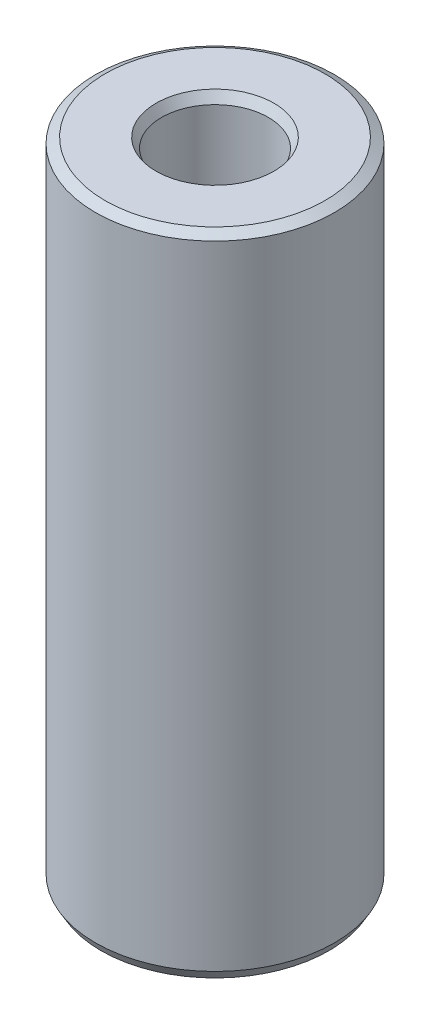
from build123d import *
from OCP.BRepFilletAPI import BRepFilletAPI_MakeChamfer

# Parameters (mm, degrees)
SKETCH1_R           = 7.5
BOSS_EXTRUDE1_DEPTH = 40.644669907
SKETCH2_R           = 3.354042675
CUT_EXTRUDE1_DEPTH  = 43.005823309
CHAMFER1_SIZE       = 0.346688844
CHAMFER1_SIZE2      = 0.600482693


with BuildPart() as part:
    # Sketch1 → Boss-Extrude1 (new body)
    with BuildSketch(Plane(origin=(0, 0, 0), x_dir=(1, 0, 0), z_dir=(0, 1, 0))):
        Circle(SKETCH1_R)
    extrude(amount=BOSS_EXTRUDE1_DEPTH)

    # Sketch2 → Cut-Extrude1 (cut, through all)
    with BuildSketch(Plane(origin=(0, 0, 0), x_dir=(1, 0, 0), z_dir=(0, 1, 0))):
        Circle(SKETCH2_R)
    extrude(amount=CUT_EXTRUDE1_DEPTH, mode=Mode.SUBTRACT)

    # Chamfer1: one chamfer whose edges measure the first distance from different faces: ONE call of the kernel's chamfer builder (chamfer() names one face for all edges)
    chamfer1_edges_1 = [part.edges().sort_by_distance(p)[0] for p in [
        (-3.354042675, 40.644669907, 0),
    ]]
    chamfer1_side_1 = [part.faces().sort_by_distance(p)[0] for p in [
        (-7.287867966, 40.644669907, 0),
    ]]
    chamfer1_edges_2 = [part.edges().sort_by_distance(p)[0] for p in [
        (-3.354042675, 0, 0),
    ]]
    chamfer1_side_2 = [part.faces().sort_by_distance(p)[0] for p in [
        (-3.354042675, 20.322334953, 0),
    ]]
    chamfer1_edges_3 = [part.edges().sort_by_distance(p)[0] for p in [
        (-7.5, 0, 0),
    ]]
    chamfer1_side_3 = [part.faces().sort_by_distance(p)[0] for p in [
        (-7.287867966, 0, 0),
    ]]
    chamfer1_edges_4 = [part.edges().sort_by_distance(p)[0] for p in [
        (-7.5, 40.644669907, 0),
    ]]
    chamfer1_side_4 = [part.faces().sort_by_distance(p)[0] for p in [
        (-7.5, 20.322334953, 0),
    ]]
    chamfer1 = BRepFilletAPI_MakeChamfer(part.part.solid().wrapped)
    for e in chamfer1_edges_1:
        chamfer1.Add(CHAMFER1_SIZE, CHAMFER1_SIZE2, e.wrapped, chamfer1_side_1[0].wrapped)  # the first distance lies on this face
    for e in chamfer1_edges_2:
        chamfer1.Add(CHAMFER1_SIZE, CHAMFER1_SIZE2, e.wrapped, chamfer1_side_2[0].wrapped)  # the first distance lies on this face
    for e in chamfer1_edges_3:
        chamfer1.Add(CHAMFER1_SIZE, CHAMFER1_SIZE2, e.wrapped, chamfer1_side_3[0].wrapped)  # the first distance lies on this face
    for e in chamfer1_edges_4:
        chamfer1.Add(CHAMFER1_SIZE, CHAMFER1_SIZE2, e.wrapped, chamfer1_side_4[0].wrapped)  # the first distance lies on this face
    add(Compound.cast(chamfer1.Shape()), mode=Mode.REPLACE)


solid = part.part
